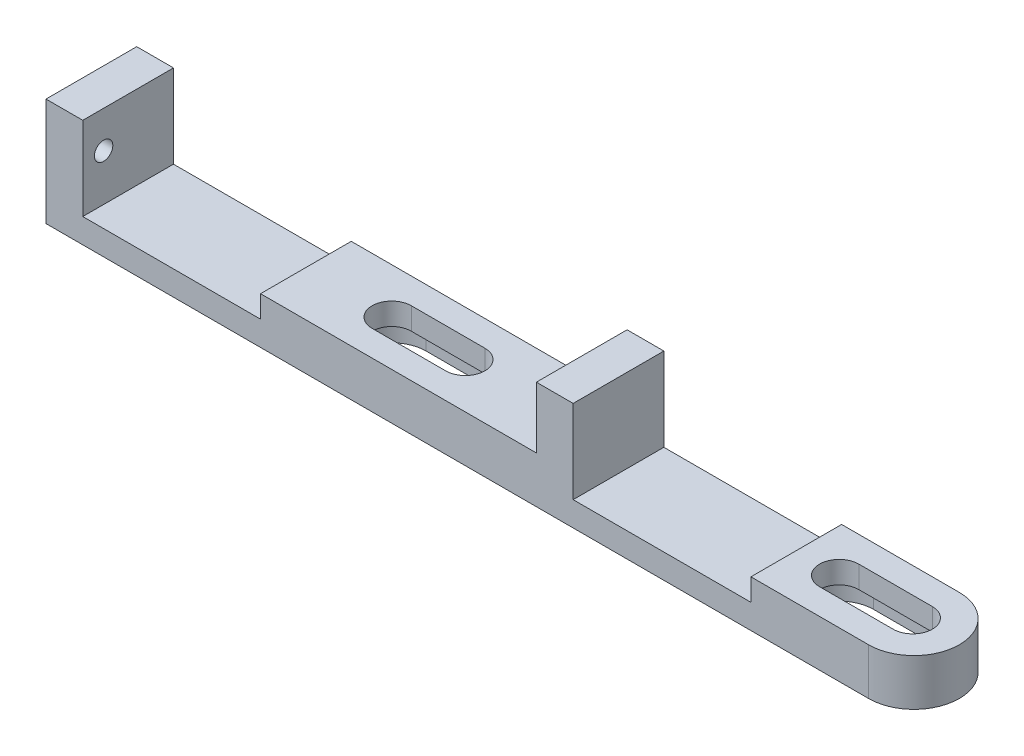
from build123d import *

# Parameters (mm, degrees)
BOSS_EXTRUDE1_DEPTH = 7.4
CUT_EXTRUDE1_DEPTH  = 10
CUT_EXTRUDE2_START  = -2
CUT_EXTRUDE2_DEPTH  = 2
CUT_EXTRUDE3_REACH  = 73.728
SKETCH5_R           = 0.75
CUT_EXTRUDE4_DEPTH  = 10


with BuildPart() as part:
    # Sketch1 → Boss-Extrude1 (new body)
    with BuildSketch(Plane.XY):
        Polygon((0, 0), (0, 8.8), (3, 8.8), (3, 2), (17.5, 2), (17.5, 3.8), (40, 3.8), (40, 8.8), (43, 8.8), (43, 2), (57.5, 2), (57.5, 3.8), (70.8, 3.8), (70.8, 0), align=None)
    extrude(amount=BOSS_EXTRUDE1_DEPTH)

    # Sketch3 → Cut-Extrude1 (cut)
    with BuildSketch(Plane(origin=(0, 3.8, 0), x_dir=(1, 0, 0), z_dir=(0, 1, 0))):
        with BuildLine():
            Line((30.5, -5.3), (24.5, -5.3))
            ThreePointArc((24.5, -5.3), (22.9, -3.7), (24.5, -2.1))
            Line((24.5, -2.1), (30.5, -2.1))
            ThreePointArc((30.5, -2.1), (32.1, -3.7), (30.5, -5.3))
        make_face()
        with BuildLine():
            Line((67, -5.3), (61, -5.3))
            ThreePointArc((61, -5.3), (59.4, -3.7), (61, -2.1))
            Line((61, -2.1), (67, -2.1))
            ThreePointArc((67, -2.1), (68.6, -3.7), (67, -5.3))
        make_face()
    extrude(amount=-CUT_EXTRUDE1_DEPTH, mode=Mode.SUBTRACT)

    # Sketch4 → Cut-Extrude2 (cut)
    # profile 1 of 2: a face of its own
    with BuildSketch(Plane.XZ.offset(CUT_EXTRUDE2_START)):
        with BuildLine():
            Line((24.5, 6.5), (30.5, 6.5))
            ThreePointArc((30.5, 6.5), (33.3, 3.7), (30.5, 0.9))
            Line((30.5, 0.9), (24.5, 0.9))
            ThreePointArc((24.5, 0.9), (21.7, 3.7), (24.5, 6.5))
        make_face()
        with BuildLine():
            Line((24.5, 5.3), (30.5, 5.3))
            ThreePointArc((30.5, 5.3), (32.1, 3.7), (30.5, 2.1))
            Line((30.5, 2.1), (24.5, 2.1))
            ThreePointArc((24.5, 2.1), (22.9, 3.7), (24.5, 5.3))
        make_face(mode=Mode.SUBTRACT)
    # profile 2 of 2: a face of its own
    with BuildSketch(Plane.XZ.offset(CUT_EXTRUDE2_START)):
        with BuildLine():
            Line((61, 6.5), (67, 6.5))
            ThreePointArc((67, 6.5), (69.8, 3.7), (67, 0.9))
            Line((67, 0.9), (61, 0.9))
            ThreePointArc((61, 0.9), (58.2, 3.7), (61, 6.5))
        make_face()
        with BuildLine():
            Line((61, 5.3), (67, 5.3))
            ThreePointArc((67, 5.3), (68.6, 3.7), (67, 2.1))
            Line((67, 2.1), (61, 2.1))
            ThreePointArc((61, 2.1), (59.4, 3.7), (61, 5.3))
        make_face(mode=Mode.SUBTRACT)
    extrude(amount=CUT_EXTRUDE2_DEPTH, mode=Mode.SUBTRACT)

    # Sketch5 → Cut-Extrude3 (cut, up to next)
    with BuildSketch(Plane.ZY, mode=Mode.PRIVATE) as cut_extrude3_sk1:
        with Locations((5.7, 5.8)):
            Circle(SKETCH5_R)
    cut_extrude3_tool1 = extrude(cut_extrude3_sk1.sketch, amount=-CUT_EXTRUDE3_REACH, mode=Mode.PRIVATE) & part.part
    add(cut_extrude3_tool1.solids().sort_by_distance((0, 5.8, 5.7))[0], mode=Mode.SUBTRACT)

    # Sketch6 → Cut-Extrude4 (cut)
    with BuildSketch(Plane.XZ):
        with BuildLine():
            Line((67.1, 0), (70.8, 0))
            Line((70.8, 0), (70.8, 3.7))
            ThreePointArc((70.8, 3.7), (69.71629509, 1.08370491), (67.1, 0))
        make_face()
        with BuildLine():
            ThreePointArc((67.1, 7.4), (69.71629509, 6.31629509), (70.8, 3.7))
            Line((70.8, 3.7), (70.8, 7.4))
            Line((70.8, 7.4), (67.1, 7.4))
        make_face()
    extrude(amount=-CUT_EXTRUDE4_DEPTH, mode=Mode.SUBTRACT)


solid = part.part
